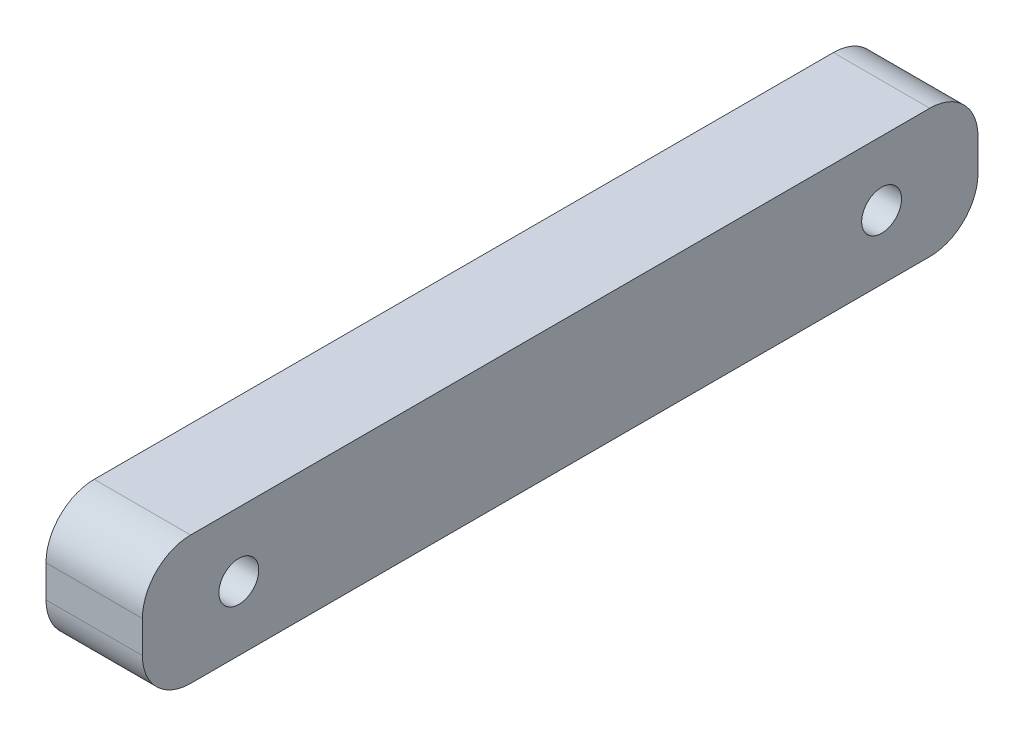
from build123d import *

# Parameters (mm, degrees)
SKETCH1_R           = 3.937
BOSS_EXTRUDE1_DEPTH = 19.05


with BuildPart() as part:
    # Sketch1 → Boss-Extrude1 (new body)
    with BuildSketch(Plane(origin=(0, 0, 0), x_dir=(0, 0, -1), z_dir=(1, 0, 0))):
        with BuildLine():
            Line((9.525, 0), (155.575, 0))
            ThreePointArc((155.575, 0), (162.310192091, -2.789807909), (165.1, -9.525))
            Line((165.1, -9.525), (165.1, -15.875))
            ThreePointArc((165.1, -15.875), (162.310192091, -22.610192091), (155.575, -25.4))
            Line((155.575, -25.4), (9.525, -25.4))
            ThreePointArc((9.525, -25.4), (2.789807909, -22.610192091), (0, -15.875))
            Line((0, -15.875), (0, -9.525))
            ThreePointArc((0, -9.525), (2.789807909, -2.789807909), (9.525, 0))
        make_face()
        with Locations((19.05, -12.7)):
            Circle(SKETCH1_R, mode=Mode.SUBTRACT)
        with Locations((146.05, -12.7)):
            Circle(SKETCH1_R, mode=Mode.SUBTRACT)
    extrude(amount=BOSS_EXTRUDE1_DEPTH)


solid = part.part
